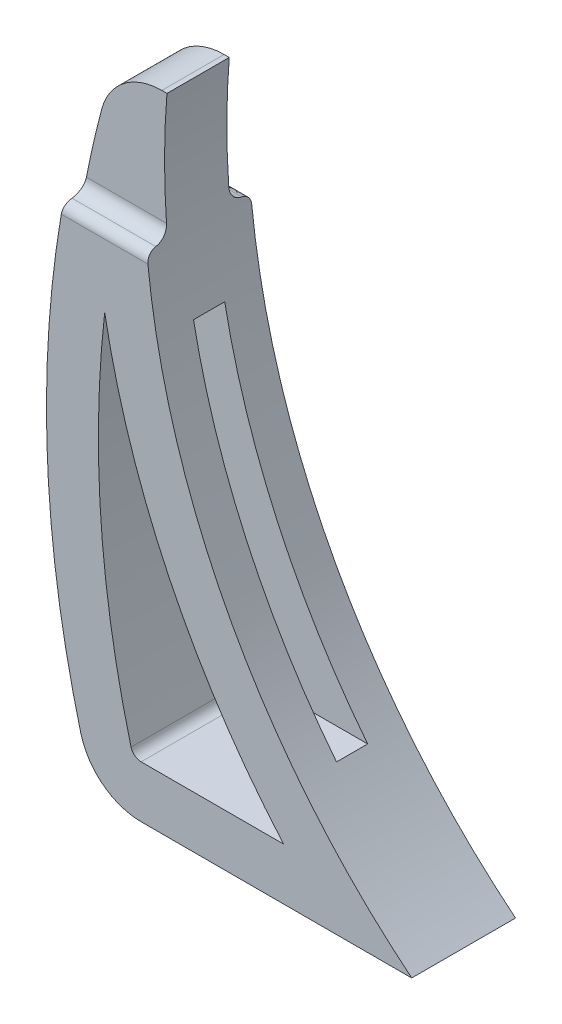
from build123d import *

# Parameters (mm, degrees)
BOSS_EXTRU_1_DEPTH      = 10
ENL_V_START             = 3
ESQUISSE3_W             = 3
ESQUISSE3_H             = 30
ENL_V_MAT_EXTRU_2_DEPTH = 66.07803068
BOSS_EXTRU_2_START      = 4.5
BOSS_EXTRU_2_DEPTH      = 20
ENL_V_MAT_EXTRU_3_DEPTH = 2
ENL_V_MAT_EXTRU_3_TAPER = -30
CONG_1_R                = 1.325
CONG_2_R                = 1.325
CONG_VARIABLE1_R        = 1


with BuildPart() as part:
    # Esquisse1 → Boss.-Extru.1 (new body)
    with BuildSketch(Plane.XY):
        with BuildLine():
            Line((4.509378002, 0), (30.57152697, 0))
            ThreePointArc((30.57152697, 0), (10.370789772, 26.839796662), (5, 60))
            Line((5, 60), (4.509378002, 60))
            ThreePointArc((4.509378002, 60), (0.848195772, 58.753498152), (-1.291762986, 55.531914894))
            ThreePointArc((-1.291762986, 55.531914894), (-4.606079858, 30), (-1.291762986, 4.468085106))
            ThreePointArc((-1.291762986, 4.468085106), (0.848195772, 1.246501848), (4.509378002, 0))
        make_face()
        with BuildLine():
            Line((4.509378002, 5), (18.232904672, 5))
            ThreePointArc((18.232904672, 5), (7.212441996, 21.704317491), (1.001630768, 40.728266722))
            ThreePointArc((1.001630768, 40.728266722), (0.643507572, 23.118189348), (3.54252117, 5.744680851))
            ThreePointArc((3.54252117, 5.744680851), (3.899180963, 5.207750308), (4.509378002, 5))
        make_face(mode=Mode.SUBTRACT)
    extrude(amount=BOSS_EXTRU_1_DEPTH)

    # Esquisse3 → Enlèv. mat.-Extru.2 (cut, through all)
    with BuildSketch(Plane(origin=(0, 0, 0), x_dir=(0, 0, -1), z_dir=(1, 0, 0)).offset(ENL_V_START)):
        with Locations((-5, 25.901656599)):
            Rectangle(ESQUISSE3_W, ESQUISSE3_H)
    extrude(amount=ENL_V_MAT_EXTRU_2_DEPTH, mode=Mode.SUBTRACT)


with BuildPart() as boss_extru_2_tool:
    # Esquisse4 → Boss.-Extru.2 (new body)
    with BuildSketch(Plane(origin=(0, 0, 0), x_dir=(0, 0, -1), z_dir=(1, 0, 0)).offset(BOSS_EXTRU_2_START)):
        Polygon((-7.75, 0), (-2.25, 0), (-3.053847577, -3), (-6.946152423, -3), align=None)
    extrude(amount=BOSS_EXTRU_2_DEPTH)


with BuildPart() as part_1:
    add(part.part)


with BuildPart() as part_2:
    # Boss.-Extru.2: joined with boss_extru_2_tool
    add(part_1.part.fuse(boss_extru_2_tool.part, tol=0.00001))

    # Esquisse6 → Enlèv. mat.-Extru.3 (cut)
    with BuildSketch(Plane.XY):
        with BuildLine():
            Line((-2.972740877, 48), (5.048977769, 48))
            ThreePointArc((5.048977769, 48), (4.766869828, 53.998948533), (5, 60))
            Line((5, 60), (4.509378002, 60))
            ThreePointArc((4.509378002, 60), (0.848195772, 58.753498152), (-1.291762986, 55.531914894))
            ThreePointArc((-1.291762986, 55.531914894), (-2.204935767, 51.782179075), (-2.972740877, 48))
        make_face()
    enl_v_mat_extru_3 = extrude(amount=ENL_V_MAT_EXTRU_3_DEPTH, taper=ENL_V_MAT_EXTRU_3_TAPER, mode=Mode.SUBTRACT)

    # Symétrie1: Enlèv. mat.-Extru.3 across plane
    add(enl_v_mat_extru_3.mirror(Plane(origin=(0, 0, 5), x_dir=(1, 0, 0), z_dir=(0, 0, -1))), mode=Mode.SUBTRACT)

    # Congé1
    cong_1_edges = [part_2.edges().sort_by_distance(p)[0] for p in [
        (0.992837273, 46.845299462, 8),
    ]]
    fillet(cong_1_edges, radius=CONG_1_R)

    # Congé2
    cong_2_edges = [part_2.edges().sort_by_distance(p)[0] for p in [
        (0.992837273, 46.845299462, 2),
    ]]
    fillet(cong_2_edges, radius=CONG_2_R)

    # Congé variable1
    cong_variable1_edges = [part_2.edges().sort_by_distance(p)[0] for p in [
        (1.038118446, 48, 0),
        (1.038118446, 48, 10),
    ]]
    fillet(cong_variable1_edges, radius=CONG_VARIABLE1_R)


solid = part_2.part
